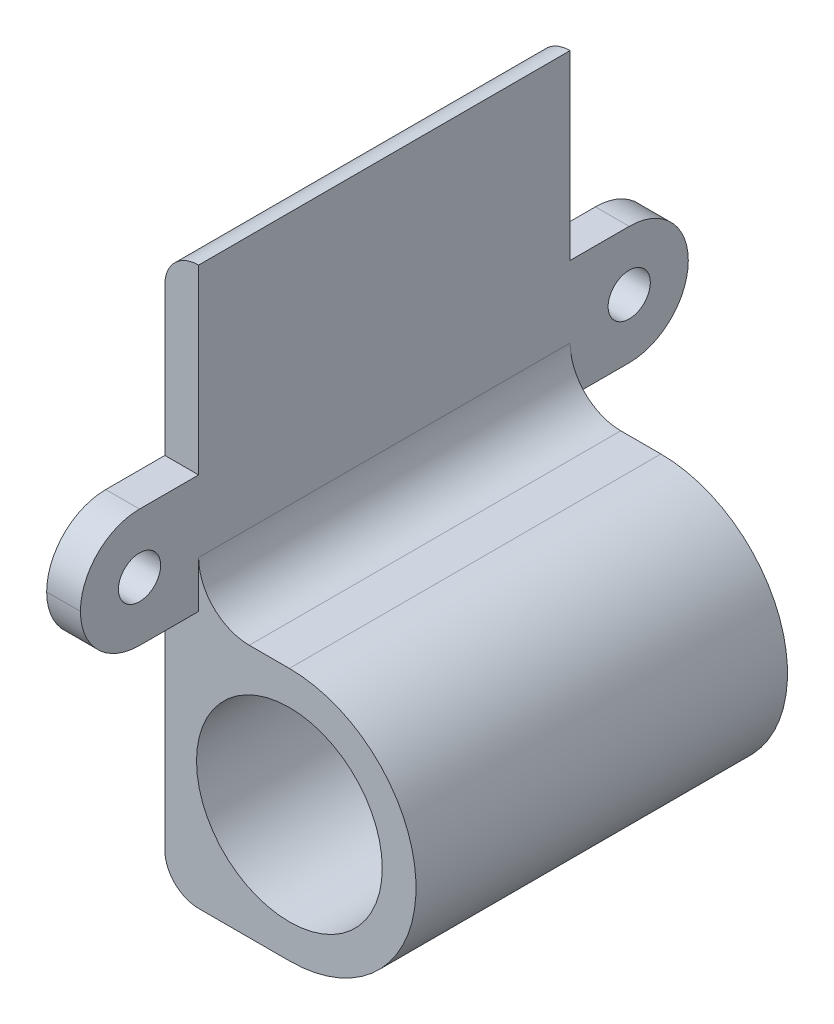
from build123d import *

# Parameters (mm, degrees)
SKETCH2_R            = 11
BOSS_EXTRUDE1_DEPTH  = 44
SKETCH5_W            = 4
SKETCH5_H            = 14
BOSS_EXTRUDE3_DEPTH  = 14
FILLET3_R            = 7
SKETCH6_R            = 2.5
CUT_EXTRUDE2_DEPTH   = 14
FILLET3_OF_MIRROR2_R = 7


with BuildPart() as part:
    # Sketch2 → Boss-Extrude1 (new body)
    with BuildSketch(Plane.XY):
        with BuildLine():
            Line((0, 4), (0, 62))
            ThreePointArc((0, 62), (1.171572875, 64.828427125), (4, 66))
            Line((4, 66), (4, 36))
            ThreePointArc((4, 36), (5.757359313, 31.757359313), (10, 30))
            Line((10, 30), (14.75, 30))
            ThreePointArc((14.75, 30), (18.324268314, 29.567930739), (21.692625765, 28.296614136))
            ThreePointArc((21.692625765, 28.296614136), (29.317930739, 11.425731686), (14.75, 0))
            Line((14.75, 0), (4, 0))
            ThreePointArc((4, 0), (1.171572875, 1.171572875), (0, 4))
        make_face()
        with Locations((14.75, 15)):
            Circle(SKETCH2_R, mode=Mode.SUBTRACT)
    extrude(amount=BOSS_EXTRUDE1_DEPTH)

    # Sketch5 → Boss-Extrude3 (add)
    with BuildSketch(Plane.XY.offset(44)):
        with Locations((2, 37.473717009)):
            Rectangle(SKETCH5_W, SKETCH5_H)
    boss_extrude3 = extrude(amount=BOSS_EXTRUDE3_DEPTH)

    # Fillet3
    fillet3_edges = [part.edges().sort_by_distance(p)[0] for p in [
        (2, 30.473717009, 58),
        (2, 44.473717009, 58),
    ]]
    fillet(fillet3_edges, radius=FILLET3_R - 0.0001)  # a hair under: the kernel refuses the full size

    # Sketch6 → Cut-Extrude2 (cut)
    with BuildSketch(Plane(origin=(4, 0, 0), x_dir=(0, 0, -1), z_dir=(1, 0, 0))):
        with Locations(Location((-51, 37.473717009, 0), (0, 0, 90))):
            Circle(SKETCH6_R)
    cut_extrude2 = extrude(amount=-CUT_EXTRUDE2_DEPTH, mode=Mode.SUBTRACT)

    # Mirror2: Boss-Extrude3, Cut-Extrude2 across plane
    add(boss_extrude3.mirror(Plane(origin=(0, 0, 22), x_dir=(1, 0, 0), z_dir=(0, 0, -1))))
    add(cut_extrude2.mirror(Plane(origin=(0, 0, 22), x_dir=(1, 0, 0), z_dir=(0, 0, -1))), mode=Mode.SUBTRACT)

    # Fillet3 of Mirror2
    fillet3_of_mirror2_edges = [part.edges().sort_by_distance(p)[0] for p in [
        (2, 30.473717009, -14),
        (2, 44.473717009, -14),
    ]]
    fillet(fillet3_of_mirror2_edges, radius=FILLET3_OF_MIRROR2_R - 0.0001)  # a hair under: the kernel refuses the full size


solid = part.part
